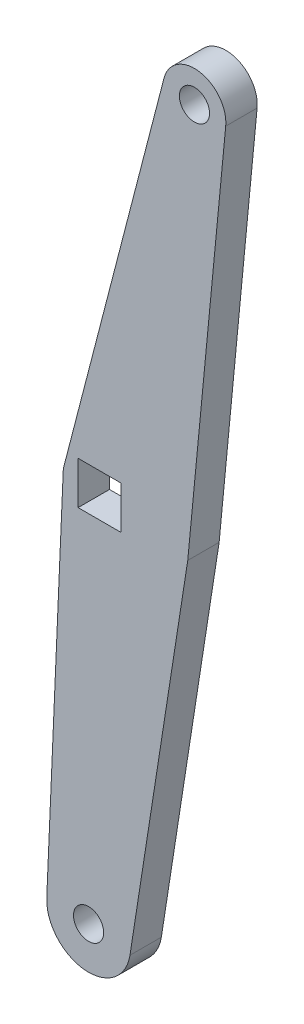
from build123d import *

# Parameters (mm, degrees)
SKETCH1_R           = 2.286
SKETCH1_W           = 6.477
SKETCH1_H           = 6.477
BOSS_EXTRUDE1_DEPTH = 4.7625


with BuildPart() as part:
    # Sketch1 → Boss-Extrude1 (new body)
    with BuildSketch(Plane.XY):
        with BuildLine():
            Line((-6.343970195, 0.276662558), (-3.831565178, 57.886997247))
            Line((-3.831565178, 57.886997247), (11.444846528, 116.828936451))
            ThreePointArc((11.444846528, 116.828936451), (16.882843806, 120.324085411), (20.795677535, 115.178445231))
            Line((20.795677535, 115.178445231), (15.037429691, 55.26716278))
            Line((15.037429691, 55.26716278), (6.27430308, -0.977558621))
            ThreePointArc((6.27430308, -0.977558621), (-0.628077279, -6.318862155), (-6.343970195, 0.276662558))
        make_face()
        Circle(SKETCH1_R, mode=Mode.SUBTRACT)
        with Locations((16.05502355, 115.634083292)):
            Circle(SKETCH1_R, mode=Mode.SUBTRACT)
        with Locations((1.647656267, 57.126243784)):
            Rectangle(SKETCH1_W, SKETCH1_H, mode=Mode.SUBTRACT)
    extrude(amount=BOSS_EXTRUDE1_DEPTH)


solid = part.part
